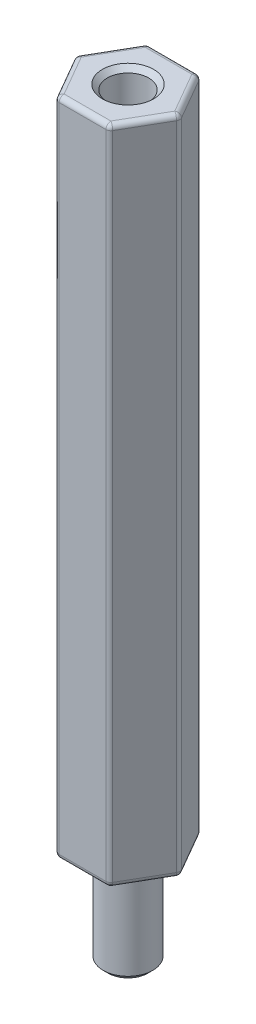
from build123d import *

# Parameters (mm, degrees)
SKETCH1_R           = 1.25
BOSS_EXTRUDE1_DEPTH = 40
FILLET1_R           = 0.3
FILLET2_R           = 0.3
SKETCH2_R           = 1.5
BOSS_EXTRUDE2_DEPTH = 6
CHAMFER1_SIZE       = 0.3
FILLET3_R           = 0.3


with BuildPart() as part:
    # Sketch1 → Boss-Extrude1 (new body)
    with BuildSketch(Plane(origin=(0, 0, 0), x_dir=(1, 0, 0), z_dir=(0, 1, 0))):
        Polygon((-1.58771324, 2.75), (-3.175426481, 0), (-1.58771324, -2.75), (1.58771324, -2.75), (3.175426481, 0), (1.58771324, 2.75), align=None)
        Circle(SKETCH1_R, mode=Mode.SUBTRACT)
    extrude(amount=BOSS_EXTRUDE1_DEPTH)

    # Fillet1
    fillet1_edges = [part.edges().sort_by_distance(p)[0] for p in [
        (1.58771324, 20, -2.75),
        (3.175426481, 20, 0),
        (-1.58771324, 20, -2.75),
        (-3.175426481, 20, 0),
        (-1.58771324, 20, 2.75),
        (1.58771324, 20, 2.75),
    ]]
    fillet(fillet1_edges, radius=FILLET1_R)

    # Fillet2
    fillet2_edges = [part.edges().sort_by_distance(p)[0] for p in [
        (-1.56450816, 0, 2.709807621),
        (-2.38156986, 0, 1.375),
        (-3.129016319, 0, 0),
        (-2.38156986, 0, -1.375),
        (-1.56450816, 0, -2.709807621),
        (0, 0, -2.75),
        (1.56450816, 0, -2.709807621),
        (2.38156986, 0, -1.375),
        (3.129016319, 0, 0),
        (2.38156986, 0, 1.375),
        (1.56450816, 0, 2.709807621),
        (-1.56450816, 40, 2.709807621),
        (-2.38156986, 40, 1.375),
        (-3.129016319, 40, 0),
        (-2.38156986, 40, -1.375),
        (-1.56450816, 40, -2.709807621),
        (0, 40, -2.75),
        (1.56450816, 40, -2.709807621),
        (2.38156986, 40, -1.375),
        (3.129016319, 40, 0),
        (2.38156986, 40, 1.375),
        (1.56450816, 40, 2.709807621),
        (0, 0, 2.75),
        (0, 40, 2.75),
    ]]
    fillet(fillet2_edges, radius=FILLET2_R)

    # Sketch2 → Boss-Extrude2 (add)
    with BuildSketch(Plane.XZ):
        Circle(SKETCH2_R)
    extrude(amount=BOSS_EXTRUDE2_DEPTH)

    # Chamfer1
    chamfer1_edges = [part.edges().sort_by_distance(p)[0] for p in [
        (-1.25, 40, 0),
        (-1.5, -6, 0),
    ]]
    chamfer(chamfer1_edges, length=CHAMFER1_SIZE)

    # Fillet3
    fillet3_edges = [part.edges().sort_by_distance(p)[0] for p in [
        (-1.5, 0, 0),
    ]]
    fillet(fillet3_edges, radius=FILLET3_R)


solid = part.part
